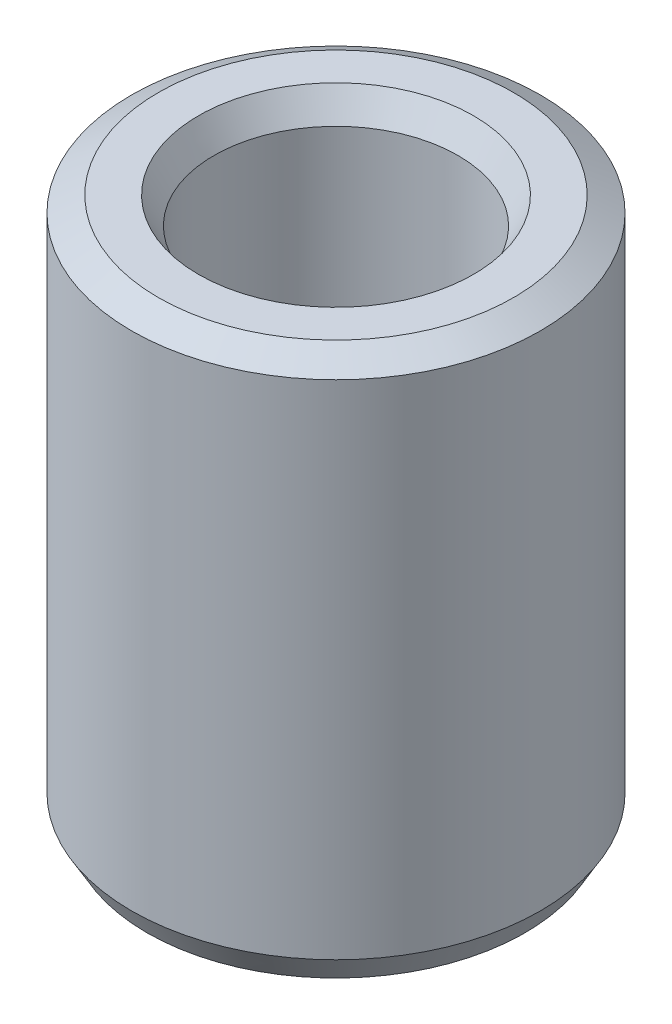
from build123d import *
from OCP.BRepFilletAPI import BRepFilletAPI_MakeChamfer

# Parameters (mm, degrees)
SKETCH1_R           = 10
BOSS_EXTRUDE1_DEPTH = 26.64048685
SKETCH2_R           = 5.971847205
CUT_EXTRUDE1_DEPTH  = 31.161491004
CHAMFER1_SIZE       = 0.75578005
CHAMFER1_SIZE2      = 1.309049445


with BuildPart() as part:
    # Sketch1 → Boss-Extrude1 (new body)
    with BuildSketch(Plane(origin=(0, 0, 0), x_dir=(1, 0, 0), z_dir=(0, 1, 0))):
        Circle(SKETCH1_R)
    extrude(amount=BOSS_EXTRUDE1_DEPTH)

    # Sketch2 → Cut-Extrude1 (cut, through all)
    with BuildSketch(Plane(origin=(0, 0, 0), x_dir=(1, 0, 0), z_dir=(0, 1, 0))):
        Circle(SKETCH2_R)
    extrude(amount=CUT_EXTRUDE1_DEPTH, mode=Mode.SUBTRACT)

    # Chamfer1: one chamfer whose edges measure the first distance from different faces: ONE call of the kernel's chamfer builder (chamfer() names one face for all edges)
    chamfer1_edges_1 = [part.edges().sort_by_distance(p)[0] for p in [
        (-5.971847205, 26.64048685, 0),
    ]]
    chamfer1_side_1 = [part.faces().sort_by_distance(p)[0] for p in [
        (-9.717157288, 26.64048685, 0),
    ]]
    chamfer1_edges_2 = [part.edges().sort_by_distance(p)[0] for p in [
        (-5.971847205, 0, 0),
    ]]
    chamfer1_side_2 = [part.faces().sort_by_distance(p)[0] for p in [
        (-5.971847205, 13.320243425, 0),
    ]]
    chamfer1_edges_3 = [part.edges().sort_by_distance(p)[0] for p in [
        (-10, 0, 0),
    ]]
    chamfer1_side_3 = [part.faces().sort_by_distance(p)[0] for p in [
        (-9.717157288, 0, 0),
    ]]
    chamfer1_edges_4 = [part.edges().sort_by_distance(p)[0] for p in [
        (-10, 26.64048685, 0),
    ]]
    chamfer1_side_4 = [part.faces().sort_by_distance(p)[0] for p in [
        (-10, 13.320243425, 0),
    ]]
    chamfer1 = BRepFilletAPI_MakeChamfer(part.part.solid().wrapped)
    for e in chamfer1_edges_1:
        chamfer1.Add(CHAMFER1_SIZE, CHAMFER1_SIZE2, e.wrapped, chamfer1_side_1[0].wrapped)  # the first distance lies on this face
    for e in chamfer1_edges_2:
        chamfer1.Add(CHAMFER1_SIZE, CHAMFER1_SIZE2, e.wrapped, chamfer1_side_2[0].wrapped)  # the first distance lies on this face
    for e in chamfer1_edges_3:
        chamfer1.Add(CHAMFER1_SIZE, CHAMFER1_SIZE2, e.wrapped, chamfer1_side_3[0].wrapped)  # the first distance lies on this face
    for e in chamfer1_edges_4:
        chamfer1.Add(CHAMFER1_SIZE, CHAMFER1_SIZE2, e.wrapped, chamfer1_side_4[0].wrapped)  # the first distance lies on this face
    add(Compound.cast(chamfer1.Shape()), mode=Mode.REPLACE)


solid = part.part
